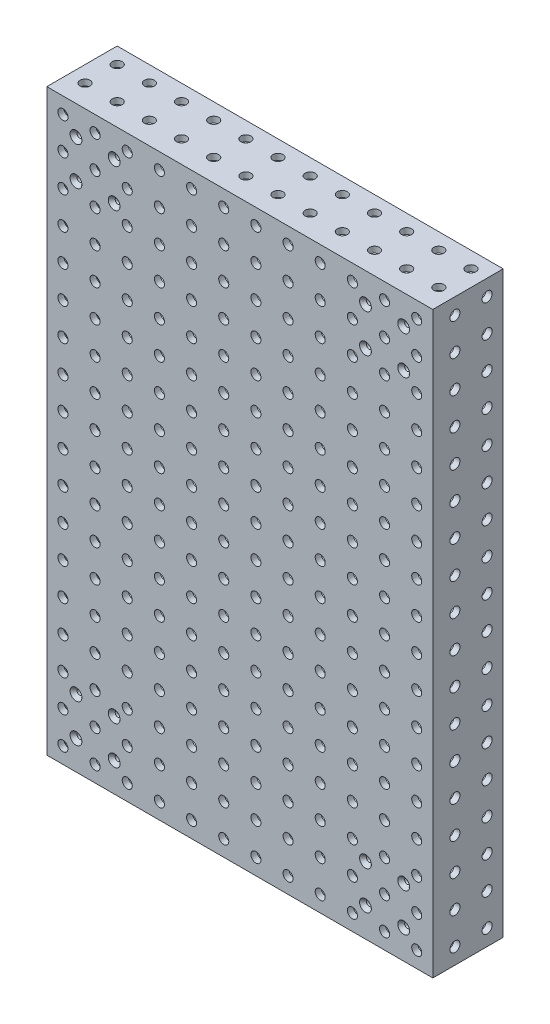
from build123d import *

# Parameters (mm, degrees)
SKETCH1_W           = 609.6
SKETCH1_H           = 914.4
SKETCH1_R           = 7.9375
SKETCH1_R_2         = 4.233291
BOSS_EXTRUDE1_DEPTH = 9.525
SKETCH2_W           = 609.6
SKETCH2_H           = 914.4
SKETCH2_W_2         = 590.55
SKETCH2_H_2         = 895.35
BOSS_EXTRUDE2_DEPTH = 111.125
SKETCH3_R           = 7.9375
CUT_EXTRUDE1_DEPTH  = 1104.658497906
SKETCH4_R           = 7.9375
CUT_EXTRUDE2_DEPTH  = 1104.658497906
CHAMFER1_SIZE       = 5.08
CHAMFER1_SIZE2      = 5.843871509


with BuildPart() as part:
    # Sketch1 → Boss-Extrude1 (new body)
    with BuildSketch(Plane.XY):
        with Locations((304.8, 457.2)):
            Rectangle(SKETCH1_W, SKETCH1_H)
        with Locations((25.4, 25.4)):
            Circle(SKETCH1_R, mode=Mode.SUBTRACT)
        with Locations((76.2, 25.4)):
            Circle(SKETCH1_R, mode=Mode.SUBTRACT)
        with Locations((127, 25.4)):
            Circle(SKETCH1_R, mode=Mode.SUBTRACT)
        with Locations((177.8, 25.4)):
            Circle(SKETCH1_R, mode=Mode.SUBTRACT)
        with Locations((228.6, 25.4)):
            Circle(SKETCH1_R, mode=Mode.SUBTRACT)
        with Locations((279.4, 25.4)):
            Circle(SKETCH1_R, mode=Mode.SUBTRACT)
        with Locations((330.2, 25.4)):
            Circle(SKETCH1_R, mode=Mode.SUBTRACT)
        with Locations((381, 25.4)):
            Circle(SKETCH1_R, mode=Mode.SUBTRACT)
        with Locations((431.8, 25.4)):
            Circle(SKETCH1_R, mode=Mode.SUBTRACT)
        with Locations((482.6, 25.4)):
            Circle(SKETCH1_R, mode=Mode.SUBTRACT)
        with Locations((533.4, 25.4)):
            Circle(SKETCH1_R, mode=Mode.SUBTRACT)
        with Locations((584.2, 25.4)):
            Circle(SKETCH1_R, mode=Mode.SUBTRACT)
        with Locations((76.2, 76.2)):
            Circle(SKETCH1_R, mode=Mode.SUBTRACT)
        with Locations((127, 76.2)):
            Circle(SKETCH1_R, mode=Mode.SUBTRACT)
        with Locations((177.8, 76.2)):
            Circle(SKETCH1_R, mode=Mode.SUBTRACT)
        with Locations((228.6, 76.2)):
            Circle(SKETCH1_R, mode=Mode.SUBTRACT)
        with Locations((279.4, 76.2)):
            Circle(SKETCH1_R, mode=Mode.SUBTRACT)
        with Locations((330.2, 76.2)):
            Circle(SKETCH1_R, mode=Mode.SUBTRACT)
        with Locations((381, 76.2)):
            Circle(SKETCH1_R, mode=Mode.SUBTRACT)
        with Locations((431.8, 76.2)):
            Circle(SKETCH1_R, mode=Mode.SUBTRACT)
        with Locations((482.6, 76.2)):
            Circle(SKETCH1_R, mode=Mode.SUBTRACT)
        with Locations((533.4, 76.2)):
            Circle(SKETCH1_R, mode=Mode.SUBTRACT)
        with Locations((584.2, 76.2)):
            Circle(SKETCH1_R, mode=Mode.SUBTRACT)
        with Locations((76.2, 127)):
            Circle(SKETCH1_R, mode=Mode.SUBTRACT)
        with Locations((127, 127)):
            Circle(SKETCH1_R, mode=Mode.SUBTRACT)
        with Locations((177.8, 127)):
            Circle(SKETCH1_R, mode=Mode.SUBTRACT)
        with Locations((228.6, 127)):
            Circle(SKETCH1_R, mode=Mode.SUBTRACT)
        with Locations((279.4, 127)):
            Circle(SKETCH1_R, mode=Mode.SUBTRACT)
        with Locations((330.2, 127)):
            Circle(SKETCH1_R, mode=Mode.SUBTRACT)
        with Locations((381, 127)):
            Circle(SKETCH1_R, mode=Mode.SUBTRACT)
        with Locations((431.8, 127)):
            Circle(SKETCH1_R, mode=Mode.SUBTRACT)
        with Locations((482.6, 127)):
            Circle(SKETCH1_R, mode=Mode.SUBTRACT)
        with Locations((533.4, 127)):
            Circle(SKETCH1_R, mode=Mode.SUBTRACT)
        with Locations((584.2, 127)):
            Circle(SKETCH1_R, mode=Mode.SUBTRACT)
        with Locations((76.2, 177.8)):
            Circle(SKETCH1_R, mode=Mode.SUBTRACT)
        with Locations((127, 177.8)):
            Circle(SKETCH1_R, mode=Mode.SUBTRACT)
        with Locations((177.8, 177.8)):
            Circle(SKETCH1_R, mode=Mode.SUBTRACT)
        with Locations((228.6, 177.8)):
            Circle(SKETCH1_R, mode=Mode.SUBTRACT)
        with Locations((279.4, 177.8)):
            Circle(SKETCH1_R, mode=Mode.SUBTRACT)
        with Locations((330.2, 177.8)):
            Circle(SKETCH1_R, mode=Mode.SUBTRACT)
        with Locations((381, 177.8)):
            Circle(SKETCH1_R, mode=Mode.SUBTRACT)
        with Locations((431.8, 177.8)):
            Circle(SKETCH1_R, mode=Mode.SUBTRACT)
        with Locations((482.6, 177.8)):
            Circle(SKETCH1_R, mode=Mode.SUBTRACT)
        with Locations((533.4, 177.8)):
            Circle(SKETCH1_R, mode=Mode.SUBTRACT)
        with Locations((584.2, 177.8)):
            Circle(SKETCH1_R, mode=Mode.SUBTRACT)
        with Locations((76.2, 228.6)):
            Circle(SKETCH1_R, mode=Mode.SUBTRACT)
        with Locations((127, 228.6)):
            Circle(SKETCH1_R, mode=Mode.SUBTRACT)
        with Locations((177.8, 228.6)):
            Circle(SKETCH1_R, mode=Mode.SUBTRACT)
        with Locations((228.6, 228.6)):
            Circle(SKETCH1_R, mode=Mode.SUBTRACT)
        with Locations((279.4, 228.6)):
            Circle(SKETCH1_R, mode=Mode.SUBTRACT)
        with Locations((330.2, 228.6)):
            Circle(SKETCH1_R, mode=Mode.SUBTRACT)
        with Locations((381, 228.6)):
            Circle(SKETCH1_R, mode=Mode.SUBTRACT)
        with Locations((431.8, 228.6)):
            Circle(SKETCH1_R, mode=Mode.SUBTRACT)
        with Locations((482.6, 228.6)):
            Circle(SKETCH1_R, mode=Mode.SUBTRACT)
        with Locations((533.4, 228.6)):
            Circle(SKETCH1_R, mode=Mode.SUBTRACT)
        with Locations((584.2, 228.6)):
            Circle(SKETCH1_R, mode=Mode.SUBTRACT)
        with Locations((76.2, 279.4)):
            Circle(SKETCH1_R, mode=Mode.SUBTRACT)
        with Locations((127, 279.4)):
            Circle(SKETCH1_R, mode=Mode.SUBTRACT)
        with Locations((177.8, 279.4)):
            Circle(SKETCH1_R, mode=Mode.SUBTRACT)
        with Locations((228.6, 279.4)):
            Circle(SKETCH1_R, mode=Mode.SUBTRACT)
        with Locations((279.4, 279.4)):
            Circle(SKETCH1_R, mode=Mode.SUBTRACT)
        with Locations((330.2, 279.4)):
            Circle(SKETCH1_R, mode=Mode.SUBTRACT)
        with Locations((381, 279.4)):
            Circle(SKETCH1_R, mode=Mode.SUBTRACT)
        with Locations((431.8, 279.4)):
            Circle(SKETCH1_R, mode=Mode.SUBTRACT)
        with Locations((482.6, 279.4)):
            Circle(SKETCH1_R, mode=Mode.SUBTRACT)
        with Locations((533.4, 279.4)):
            Circle(SKETCH1_R, mode=Mode.SUBTRACT)
        with Locations((584.2, 279.4)):
            Circle(SKETCH1_R, mode=Mode.SUBTRACT)
        with Locations((76.2, 330.2)):
            Circle(SKETCH1_R, mode=Mode.SUBTRACT)
        with Locations((127, 330.2)):
            Circle(SKETCH1_R, mode=Mode.SUBTRACT)
        with Locations((177.8, 330.2)):
            Circle(SKETCH1_R, mode=Mode.SUBTRACT)
        with Locations((228.6, 330.2)):
            Circle(SKETCH1_R, mode=Mode.SUBTRACT)
        with Locations((279.4, 330.2)):
            Circle(SKETCH1_R, mode=Mode.SUBTRACT)
        with Locations((330.2, 330.2)):
            Circle(SKETCH1_R, mode=Mode.SUBTRACT)
        with Locations((381, 330.2)):
            Circle(SKETCH1_R, mode=Mode.SUBTRACT)
        with Locations((431.8, 330.2)):
            Circle(SKETCH1_R, mode=Mode.SUBTRACT)
        with Locations((482.6, 330.2)):
            Circle(SKETCH1_R, mode=Mode.SUBTRACT)
        with Locations((533.4, 330.2)):
            Circle(SKETCH1_R, mode=Mode.SUBTRACT)
        with Locations((584.2, 330.2)):
            Circle(SKETCH1_R, mode=Mode.SUBTRACT)
        with Locations((76.2, 381)):
            Circle(SKETCH1_R, mode=Mode.SUBTRACT)
        with Locations((127, 381)):
            Circle(SKETCH1_R, mode=Mode.SUBTRACT)
        with Locations((177.8, 381)):
            Circle(SKETCH1_R, mode=Mode.SUBTRACT)
        with Locations((228.6, 381)):
            Circle(SKETCH1_R, mode=Mode.SUBTRACT)
        with Locations((279.4, 381)):
            Circle(SKETCH1_R, mode=Mode.SUBTRACT)
        with Locations((330.2, 381)):
            Circle(SKETCH1_R, mode=Mode.SUBTRACT)
        with Locations((381, 381)):
            Circle(SKETCH1_R, mode=Mode.SUBTRACT)
        with Locations((431.8, 381)):
            Circle(SKETCH1_R, mode=Mode.SUBTRACT)
        with Locations((482.6, 381)):
            Circle(SKETCH1_R, mode=Mode.SUBTRACT)
        with Locations((533.4, 381)):
            Circle(SKETCH1_R, mode=Mode.SUBTRACT)
        with Locations((584.2, 381)):
            Circle(SKETCH1_R, mode=Mode.SUBTRACT)
        with Locations((76.2, 431.8)):
            Circle(SKETCH1_R, mode=Mode.SUBTRACT)
        with Locations((127, 431.8)):
            Circle(SKETCH1_R, mode=Mode.SUBTRACT)
        with Locations((177.8, 431.8)):
            Circle(SKETCH1_R, mode=Mode.SUBTRACT)
        with Locations((228.6, 431.8)):
            Circle(SKETCH1_R, mode=Mode.SUBTRACT)
        with Locations((279.4, 431.8)):
            Circle(SKETCH1_R, mode=Mode.SUBTRACT)
        with Locations((330.2, 431.8)):
            Circle(SKETCH1_R, mode=Mode.SUBTRACT)
        with Locations((381, 431.8)):
            Circle(SKETCH1_R, mode=Mode.SUBTRACT)
        with Locations((431.8, 431.8)):
            Circle(SKETCH1_R, mode=Mode.SUBTRACT)
        with Locations((482.6, 431.8)):
            Circle(SKETCH1_R, mode=Mode.SUBTRACT)
        with Locations((533.4, 431.8)):
            Circle(SKETCH1_R, mode=Mode.SUBTRACT)
        with Locations((584.2, 431.8)):
            Circle(SKETCH1_R, mode=Mode.SUBTRACT)
        with Locations((76.2, 482.6)):
            Circle(SKETCH1_R, mode=Mode.SUBTRACT)
        with Locations((127, 482.6)):
            Circle(SKETCH1_R, mode=Mode.SUBTRACT)
        with Locations((177.8, 482.6)):
            Circle(SKETCH1_R, mode=Mode.SUBTRACT)
        with Locations((228.6, 482.6)):
            Circle(SKETCH1_R, mode=Mode.SUBTRACT)
        with Locations((279.4, 482.6)):
            Circle(SKETCH1_R, mode=Mode.SUBTRACT)
        with Locations((330.2, 482.6)):
            Circle(SKETCH1_R, mode=Mode.SUBTRACT)
        with Locations((381, 482.6)):
            Circle(SKETCH1_R, mode=Mode.SUBTRACT)
        with Locations((431.8, 482.6)):
            Circle(SKETCH1_R, mode=Mode.SUBTRACT)
        with Locations((482.6, 482.6)):
            Circle(SKETCH1_R, mode=Mode.SUBTRACT)
        with Locations((533.4, 482.6)):
            Circle(SKETCH1_R, mode=Mode.SUBTRACT)
        with Locations((584.2, 482.6)):
            Circle(SKETCH1_R, mode=Mode.SUBTRACT)
        with Locations((76.2, 533.4)):
            Circle(SKETCH1_R, mode=Mode.SUBTRACT)
        with Locations((127, 533.4)):
            Circle(SKETCH1_R, mode=Mode.SUBTRACT)
        with Locations((177.8, 533.4)):
            Circle(SKETCH1_R, mode=Mode.SUBTRACT)
        with Locations((228.6, 533.4)):
            Circle(SKETCH1_R, mode=Mode.SUBTRACT)
        with Locations((279.4, 533.4)):
            Circle(SKETCH1_R, mode=Mode.SUBTRACT)
        with Locations((330.2, 533.4)):
            Circle(SKETCH1_R, mode=Mode.SUBTRACT)
        with Locations((381, 533.4)):
            Circle(SKETCH1_R, mode=Mode.SUBTRACT)
        with Locations((431.8, 533.4)):
            Circle(SKETCH1_R, mode=Mode.SUBTRACT)
        with Locations((482.6, 533.4)):
            Circle(SKETCH1_R, mode=Mode.SUBTRACT)
        with Locations((533.4, 533.4)):
            Circle(SKETCH1_R, mode=Mode.SUBTRACT)
        with Locations((584.2, 533.4)):
            Circle(SKETCH1_R, mode=Mode.SUBTRACT)
        with Locations((76.2, 584.2)):
            Circle(SKETCH1_R, mode=Mode.SUBTRACT)
        with Locations((127, 584.2)):
            Circle(SKETCH1_R, mode=Mode.SUBTRACT)
        with Locations((177.8, 584.2)):
            Circle(SKETCH1_R, mode=Mode.SUBTRACT)
        with Locations((228.6, 584.2)):
            Circle(SKETCH1_R, mode=Mode.SUBTRACT)
        with Locations((279.4, 584.2)):
            Circle(SKETCH1_R, mode=Mode.SUBTRACT)
        with Locations((330.2, 584.2)):
            Circle(SKETCH1_R, mode=Mode.SUBTRACT)
        with Locations((381, 584.2)):
            Circle(SKETCH1_R, mode=Mode.SUBTRACT)
        with Locations((431.8, 584.2)):
            Circle(SKETCH1_R, mode=Mode.SUBTRACT)
        with Locations((482.6, 584.2)):
            Circle(SKETCH1_R, mode=Mode.SUBTRACT)
        with Locations((533.4, 584.2)):
            Circle(SKETCH1_R, mode=Mode.SUBTRACT)
        with Locations((584.2, 584.2)):
            Circle(SKETCH1_R, mode=Mode.SUBTRACT)
        with Locations((76.2, 635)):
            Circle(SKETCH1_R, mode=Mode.SUBTRACT)
        with Locations((127, 635)):
            Circle(SKETCH1_R, mode=Mode.SUBTRACT)
        with Locations((177.8, 635)):
            Circle(SKETCH1_R, mode=Mode.SUBTRACT)
        with Locations((228.6, 635)):
            Circle(SKETCH1_R, mode=Mode.SUBTRACT)
        with Locations((279.4, 635)):
            Circle(SKETCH1_R, mode=Mode.SUBTRACT)
        with Locations((330.2, 635)):
            Circle(SKETCH1_R, mode=Mode.SUBTRACT)
        with Locations((381, 635)):
            Circle(SKETCH1_R, mode=Mode.SUBTRACT)
        with Locations((431.8, 635)):
            Circle(SKETCH1_R, mode=Mode.SUBTRACT)
        with Locations((482.6, 635)):
            Circle(SKETCH1_R, mode=Mode.SUBTRACT)
        with Locations((533.4, 635)):
            Circle(SKETCH1_R, mode=Mode.SUBTRACT)
        with Locations((584.2, 635)):
            Circle(SKETCH1_R, mode=Mode.SUBTRACT)
        with Locations((76.2, 685.8)):
            Circle(SKETCH1_R, mode=Mode.SUBTRACT)
        with Locations((127, 685.8)):
            Circle(SKETCH1_R, mode=Mode.SUBTRACT)
        with Locations((177.8, 685.8)):
            Circle(SKETCH1_R, mode=Mode.SUBTRACT)
        with Locations((228.6, 685.8)):
            Circle(SKETCH1_R, mode=Mode.SUBTRACT)
        with Locations((279.4, 685.8)):
            Circle(SKETCH1_R, mode=Mode.SUBTRACT)
        with Locations((330.2, 685.8)):
            Circle(SKETCH1_R, mode=Mode.SUBTRACT)
        with Locations((381, 685.8)):
            Circle(SKETCH1_R, mode=Mode.SUBTRACT)
        with Locations((431.8, 685.8)):
            Circle(SKETCH1_R, mode=Mode.SUBTRACT)
        with Locations((482.6, 685.8)):
            Circle(SKETCH1_R, mode=Mode.SUBTRACT)
        with Locations((533.4, 685.8)):
            Circle(SKETCH1_R, mode=Mode.SUBTRACT)
        with Locations((584.2, 685.8)):
            Circle(SKETCH1_R, mode=Mode.SUBTRACT)
        with Locations((76.2, 736.6)):
            Circle(SKETCH1_R, mode=Mode.SUBTRACT)
        with Locations((127, 736.6)):
            Circle(SKETCH1_R, mode=Mode.SUBTRACT)
        with Locations((177.8, 736.6)):
            Circle(SKETCH1_R, mode=Mode.SUBTRACT)
        with Locations((228.6, 736.6)):
            Circle(SKETCH1_R, mode=Mode.SUBTRACT)
        with Locations((279.4, 736.6)):
            Circle(SKETCH1_R, mode=Mode.SUBTRACT)
        with Locations((330.2, 736.6)):
            Circle(SKETCH1_R, mode=Mode.SUBTRACT)
        with Locations((381, 736.6)):
            Circle(SKETCH1_R, mode=Mode.SUBTRACT)
        with Locations((431.8, 736.6)):
            Circle(SKETCH1_R, mode=Mode.SUBTRACT)
        with Locations((482.6, 736.6)):
            Circle(SKETCH1_R, mode=Mode.SUBTRACT)
        with Locations((533.4, 736.6)):
            Circle(SKETCH1_R, mode=Mode.SUBTRACT)
        with Locations((584.2, 736.6)):
            Circle(SKETCH1_R, mode=Mode.SUBTRACT)
        with Locations((76.2, 787.4)):
            Circle(SKETCH1_R, mode=Mode.SUBTRACT)
        with Locations((127, 787.4)):
            Circle(SKETCH1_R, mode=Mode.SUBTRACT)
        with Locations((177.8, 787.4)):
            Circle(SKETCH1_R, mode=Mode.SUBTRACT)
        with Locations((228.6, 787.4)):
            Circle(SKETCH1_R, mode=Mode.SUBTRACT)
        with Locations((279.4, 787.4)):
            Circle(SKETCH1_R, mode=Mode.SUBTRACT)
        with Locations((330.2, 787.4)):
            Circle(SKETCH1_R, mode=Mode.SUBTRACT)
        with Locations((381, 787.4)):
            Circle(SKETCH1_R, mode=Mode.SUBTRACT)
        with Locations((431.8, 787.4)):
            Circle(SKETCH1_R, mode=Mode.SUBTRACT)
        with Locations((482.6, 787.4)):
            Circle(SKETCH1_R, mode=Mode.SUBTRACT)
        with Locations((533.4, 787.4)):
            Circle(SKETCH1_R, mode=Mode.SUBTRACT)
        with Locations((584.2, 787.4)):
            Circle(SKETCH1_R, mode=Mode.SUBTRACT)
        with Locations((76.2, 838.2)):
            Circle(SKETCH1_R, mode=Mode.SUBTRACT)
        with Locations((127, 838.2)):
            Circle(SKETCH1_R, mode=Mode.SUBTRACT)
        with Locations((177.8, 838.2)):
            Circle(SKETCH1_R, mode=Mode.SUBTRACT)
        with Locations((228.6, 838.2)):
            Circle(SKETCH1_R, mode=Mode.SUBTRACT)
        with Locations((279.4, 838.2)):
            Circle(SKETCH1_R, mode=Mode.SUBTRACT)
        with Locations((330.2, 838.2)):
            Circle(SKETCH1_R, mode=Mode.SUBTRACT)
        with Locations((381, 838.2)):
            Circle(SKETCH1_R, mode=Mode.SUBTRACT)
        with Locations((431.8, 838.2)):
            Circle(SKETCH1_R, mode=Mode.SUBTRACT)
        with Locations((482.6, 838.2)):
            Circle(SKETCH1_R, mode=Mode.SUBTRACT)
        with Locations((533.4, 838.2)):
            Circle(SKETCH1_R, mode=Mode.SUBTRACT)
        with Locations((584.2, 838.2)):
            Circle(SKETCH1_R, mode=Mode.SUBTRACT)
        with Locations((76.2, 889)):
            Circle(SKETCH1_R, mode=Mode.SUBTRACT)
        with Locations((127, 889)):
            Circle(SKETCH1_R, mode=Mode.SUBTRACT)
        with Locations((177.8, 889)):
            Circle(SKETCH1_R, mode=Mode.SUBTRACT)
        with Locations((228.6, 889)):
            Circle(SKETCH1_R, mode=Mode.SUBTRACT)
        with Locations((279.4, 889)):
            Circle(SKETCH1_R, mode=Mode.SUBTRACT)
        with Locations((330.2, 889)):
            Circle(SKETCH1_R, mode=Mode.SUBTRACT)
        with Locations((381, 889)):
            Circle(SKETCH1_R, mode=Mode.SUBTRACT)
        with Locations((431.8, 889)):
            Circle(SKETCH1_R, mode=Mode.SUBTRACT)
        with Locations((482.6, 889)):
            Circle(SKETCH1_R, mode=Mode.SUBTRACT)
        with Locations((533.4, 889)):
            Circle(SKETCH1_R, mode=Mode.SUBTRACT)
        with Locations((584.2, 889)):
            Circle(SKETCH1_R, mode=Mode.SUBTRACT)
        with Locations((25.4, 76.2)):
            Circle(SKETCH1_R, mode=Mode.SUBTRACT)
        with Locations((25.4, 127)):
            Circle(SKETCH1_R, mode=Mode.SUBTRACT)
        with Locations((25.4, 177.8)):
            Circle(SKETCH1_R, mode=Mode.SUBTRACT)
        with Locations((25.4, 228.6)):
            Circle(SKETCH1_R, mode=Mode.SUBTRACT)
        with Locations((25.4, 279.4)):
            Circle(SKETCH1_R, mode=Mode.SUBTRACT)
        with Locations((25.4, 330.2)):
            Circle(SKETCH1_R, mode=Mode.SUBTRACT)
        with Locations((25.4, 381)):
            Circle(SKETCH1_R, mode=Mode.SUBTRACT)
        with Locations((25.4, 431.8)):
            Circle(SKETCH1_R, mode=Mode.SUBTRACT)
        with Locations((25.4, 482.6)):
            Circle(SKETCH1_R, mode=Mode.SUBTRACT)
        with Locations((25.4, 533.4)):
            Circle(SKETCH1_R, mode=Mode.SUBTRACT)
        with Locations((25.4, 584.2)):
            Circle(SKETCH1_R, mode=Mode.SUBTRACT)
        with Locations((25.4, 635)):
            Circle(SKETCH1_R, mode=Mode.SUBTRACT)
        with Locations((25.4, 685.8)):
            Circle(SKETCH1_R, mode=Mode.SUBTRACT)
        with Locations((25.4, 736.6)):
            Circle(SKETCH1_R, mode=Mode.SUBTRACT)
        with Locations((25.4, 787.4)):
            Circle(SKETCH1_R, mode=Mode.SUBTRACT)
        with Locations((25.4, 838.2)):
            Circle(SKETCH1_R, mode=Mode.SUBTRACT)
        with Locations((25.4, 889)):
            Circle(SKETCH1_R, mode=Mode.SUBTRACT)
        with Locations((46.0375, 868.3625)):
            Circle(SKETCH1_R_2, mode=Mode.SUBTRACT)
        with Locations((106.3625, 868.3625)):
            Circle(SKETCH1_R_2, mode=Mode.SUBTRACT)
        with Locations((46.0375, 808.0375)):
            Circle(SKETCH1_R_2, mode=Mode.SUBTRACT)
        with Locations((106.3625, 808.0375)):
            Circle(SKETCH1_R_2, mode=Mode.SUBTRACT)
        with Locations((503.2375, 868.3625)):
            Circle(SKETCH1_R_2, mode=Mode.SUBTRACT)
        with Locations((563.5625, 868.3625)):
            Circle(SKETCH1_R_2, mode=Mode.SUBTRACT)
        with Locations((503.2375, 808.0375)):
            Circle(SKETCH1_R_2, mode=Mode.SUBTRACT)
        with Locations((563.5625, 808.0375)):
            Circle(SKETCH1_R_2, mode=Mode.SUBTRACT)
        with Locations((46.0375, 106.3625)):
            Circle(SKETCH1_R_2, mode=Mode.SUBTRACT)
        with Locations((106.3625, 106.3625)):
            Circle(SKETCH1_R_2, mode=Mode.SUBTRACT)
        with Locations((46.0375, 46.0375)):
            Circle(SKETCH1_R_2, mode=Mode.SUBTRACT)
        with Locations((106.3625, 46.0375)):
            Circle(SKETCH1_R_2, mode=Mode.SUBTRACT)
        with Locations((503.2375, 106.3625)):
            Circle(SKETCH1_R_2, mode=Mode.SUBTRACT)
        with Locations((563.5625, 106.3625)):
            Circle(SKETCH1_R_2, mode=Mode.SUBTRACT)
        with Locations((503.2375, 46.0375)):
            Circle(SKETCH1_R_2, mode=Mode.SUBTRACT)
        with Locations((563.5625, 46.0375)):
            Circle(SKETCH1_R_2, mode=Mode.SUBTRACT)
    extrude(amount=BOSS_EXTRUDE1_DEPTH)

    # Sketch2 → Boss-Extrude2 (add)
    with BuildSketch(Plane.XY.offset(9.525)):
        with Locations((304.8, 457.2)):
            Rectangle(SKETCH2_W, SKETCH2_H)
        with Locations((304.8, 457.2)):
            Rectangle(SKETCH2_W_2, SKETCH2_H_2, mode=Mode.SUBTRACT)
    extrude(amount=-BOSS_EXTRUDE2_DEPTH)

    # Sketch3 → Cut-Extrude1 (cut, through all)
    with BuildSketch(Plane.XZ):
        with Locations((25.4, -25.4)):
            Circle(SKETCH3_R)
        with Locations((76.2, -25.4)):
            Circle(SKETCH3_R)
        with Locations((127, -25.4)):
            Circle(SKETCH3_R)
        with Locations((177.8, -25.4)):
            Circle(SKETCH3_R)
        with Locations((228.6, -25.4)):
            Circle(SKETCH3_R)
        with Locations((279.4, -25.4)):
            Circle(SKETCH3_R)
        with Locations((330.2, -25.4)):
            Circle(SKETCH3_R)
        with Locations((381, -25.4)):
            Circle(SKETCH3_R)
        with Locations((431.8, -25.4)):
            Circle(SKETCH3_R)
        with Locations((482.6, -25.4)):
            Circle(SKETCH3_R)
        with Locations((533.4, -25.4)):
            Circle(SKETCH3_R)
        with Locations((584.2, -25.4)):
            Circle(SKETCH3_R)
        with Locations((76.2, -76.2)):
            Circle(SKETCH3_R)
        with Locations((127, -76.2)):
            Circle(SKETCH3_R)
        with Locations((177.8, -76.2)):
            Circle(SKETCH3_R)
        with Locations((228.6, -76.2)):
            Circle(SKETCH3_R)
        with Locations((279.4, -76.2)):
            Circle(SKETCH3_R)
        with Locations((330.2, -76.2)):
            Circle(SKETCH3_R)
        with Locations((381, -76.2)):
            Circle(SKETCH3_R)
        with Locations((431.8, -76.2)):
            Circle(SKETCH3_R)
        with Locations((482.6, -76.2)):
            Circle(SKETCH3_R)
        with Locations((533.4, -76.2)):
            Circle(SKETCH3_R)
        with Locations((584.2, -76.2)):
            Circle(SKETCH3_R)
        with Locations((25.4, -76.2)):
            Circle(SKETCH3_R)
    extrude(amount=-CUT_EXTRUDE1_DEPTH, mode=Mode.SUBTRACT)

    # Sketch4 → Cut-Extrude2 (cut, through all)
    with BuildSketch(Plane(origin=(609.6, 0, 0), x_dir=(0, 0, -1), z_dir=(1, 0, 0))):
        with Locations((25.4, 25.4)):
            Circle(SKETCH4_R)
        with Locations((76.2, 25.4)):
            Circle(SKETCH4_R)
        with Locations((76.2, 76.2)):
            Circle(SKETCH4_R)
        with Locations((76.2, 127)):
            Circle(SKETCH4_R)
        with Locations((76.2, 177.8)):
            Circle(SKETCH4_R)
        with Locations((76.2, 228.6)):
            Circle(SKETCH4_R)
        with Locations((76.2, 279.4)):
            Circle(SKETCH4_R)
        with Locations((76.2, 330.2)):
            Circle(SKETCH4_R)
        with Locations((76.2, 381)):
            Circle(SKETCH4_R)
        with Locations((76.2, 431.8)):
            Circle(SKETCH4_R)
        with Locations((76.2, 482.6)):
            Circle(SKETCH4_R)
        with Locations((76.2, 533.4)):
            Circle(SKETCH4_R)
        with Locations((76.2, 584.2)):
            Circle(SKETCH4_R)
        with Locations((76.2, 635)):
            Circle(SKETCH4_R)
        with Locations((76.2, 685.8)):
            Circle(SKETCH4_R)
        with Locations((76.2, 736.6)):
            Circle(SKETCH4_R)
        with Locations((76.2, 787.4)):
            Circle(SKETCH4_R)
        with Locations((76.2, 838.2)):
            Circle(SKETCH4_R)
        with Locations((76.2, 889)):
            Circle(SKETCH4_R)
        with Locations((25.4, 76.2)):
            Circle(SKETCH4_R)
        with Locations((25.4, 127)):
            Circle(SKETCH4_R)
        with Locations((25.4, 177.8)):
            Circle(SKETCH4_R)
        with Locations((25.4, 228.6)):
            Circle(SKETCH4_R)
        with Locations((25.4, 279.4)):
            Circle(SKETCH4_R)
        with Locations((25.4, 330.2)):
            Circle(SKETCH4_R)
        with Locations((25.4, 381)):
            Circle(SKETCH4_R)
        with Locations((25.4, 431.8)):
            Circle(SKETCH4_R)
        with Locations((25.4, 482.6)):
            Circle(SKETCH4_R)
        with Locations((25.4, 533.4)):
            Circle(SKETCH4_R)
        with Locations((25.4, 584.2)):
            Circle(SKETCH4_R)
        with Locations((25.4, 635)):
            Circle(SKETCH4_R)
        with Locations((25.4, 685.8)):
            Circle(SKETCH4_R)
        with Locations((25.4, 736.6)):
            Circle(SKETCH4_R)
        with Locations((25.4, 787.4)):
            Circle(SKETCH4_R)
        with Locations((25.4, 838.2)):
            Circle(SKETCH4_R)
        with Locations((25.4, 889)):
            Circle(SKETCH4_R)
    extrude(amount=-CUT_EXTRUDE2_DEPTH, mode=Mode.SUBTRACT)

    # Chamfer1
    chamfer1_edges = [part.edges().sort_by_distance(p)[0] for p in [
        (41.804209, 46.0375, 9.525),
        (41.804209, 808.0375, 9.525),
        (102.129209, 808.0375, 9.525),
        (102.129209, 868.3625, 9.525),
        (41.804209, 868.3625, 9.525),
        (559.329209, 808.0375, 9.525),
        (499.004209, 808.0375, 9.525),
        (499.004209, 868.3625, 9.525),
        (559.329209, 868.3625, 9.525),
        (559.329209, 46.0375, 9.525),
        (559.329209, 106.3625, 9.525),
        (499.004209, 106.3625, 9.525),
        (499.004209, 46.0375, 9.525),
        (102.129209, 46.0375, 9.525),
        (102.129209, 106.3625, 9.525),
        (41.804209, 106.3625, 9.525),
    ]]
    chamfer1_side = [part.faces().sort_by_distance(p)[0] for p in [
        (304.8, 457.2, 9.525),
    ]]
    chamfer(chamfer1_edges, length=CHAMFER1_SIZE, length2=CHAMFER1_SIZE2, reference=chamfer1_side[0])


solid = part.part
